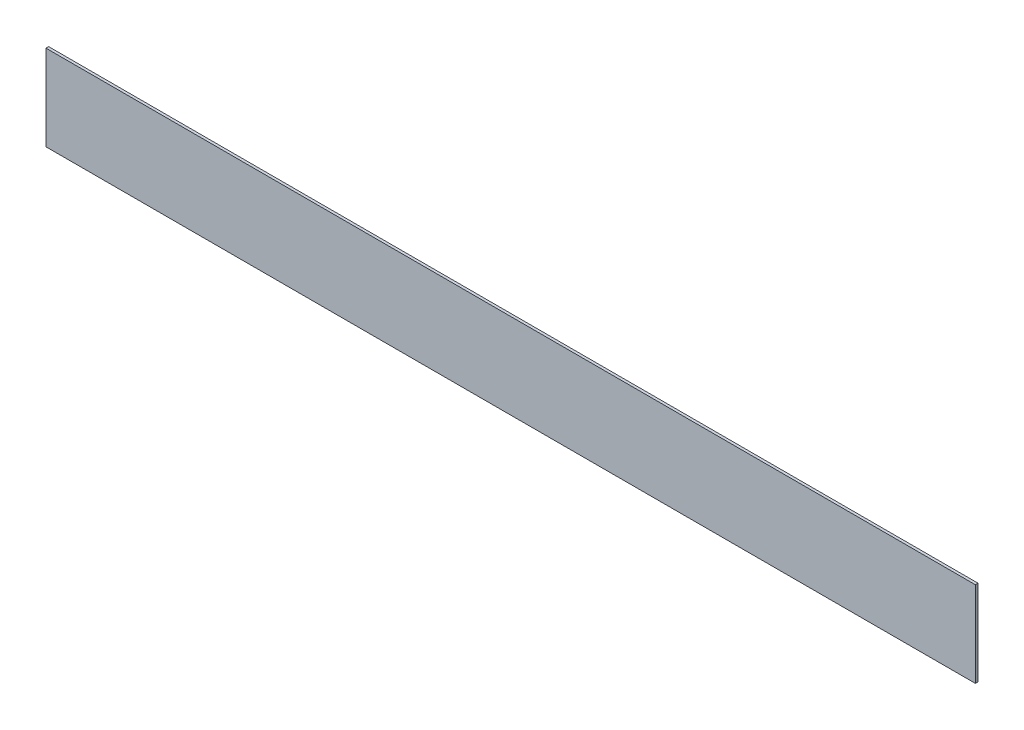
from build123d import *

# Parameters (mm, degrees)
SKETCH1_W           = 552.45
SKETCH1_H           = 50.8
BOSS_EXTRUDE1_DEPTH = 1.5875


with BuildPart() as part:
    # Sketch1 → Boss-Extrude1 (new body)
    with BuildSketch(Plane.XY):
        with Locations((276.225, 25.4)):
            Rectangle(SKETCH1_W, SKETCH1_H)
    extrude(amount=BOSS_EXTRUDE1_DEPTH)


solid = part.part
